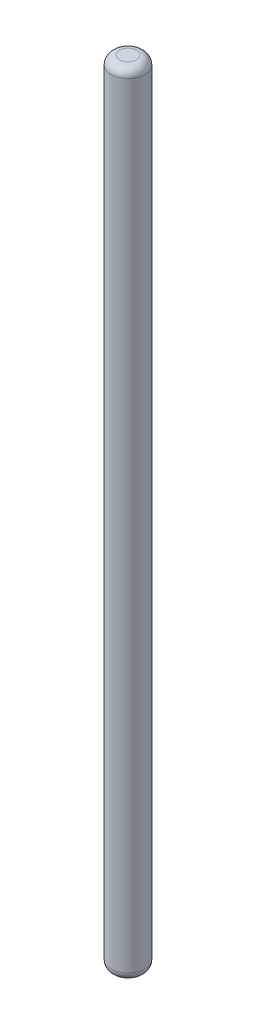
from build123d import *

# Parameters (mm, degrees)
SKETCH1_R           = 1
BOSS_EXTRUDE1_DEPTH = 47
FILLET1_R           = 0.5


with BuildPart() as part:
    # Sketch1 → Boss-Extrude1 (new body)
    with BuildSketch(Plane(origin=(0, 0, 0), x_dir=(1, 0, 0), z_dir=(0, 1, 0))):
        Circle(SKETCH1_R)
    extrude(amount=BOSS_EXTRUDE1_DEPTH)

    # Fillet1
    fillet1_edges = [part.edges().sort_by_distance(p)[0] for p in [
        (-1, 0, 0),
        (-1, 47, 0),
    ]]
    fillet(fillet1_edges, radius=FILLET1_R)


solid = part.part
